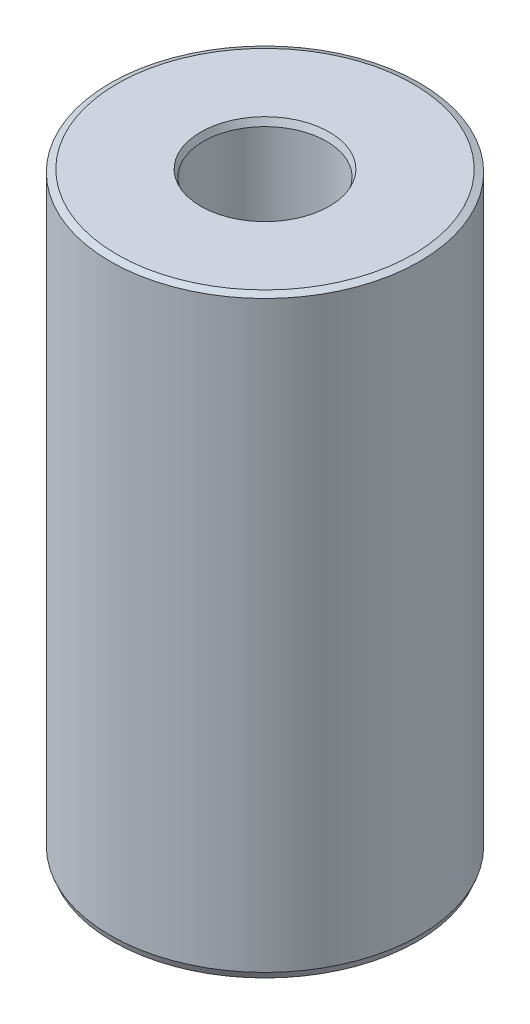
from build123d import *
from OCP.BRepFilletAPI import BRepFilletAPI_MakeChamfer

# Parameters (mm, degrees)
SKETCH1_R           = 25
BOSS_EXTRUDE1_DEPTH = 95.874018808
SKETCH2_R           = 9.962908398
CUT_EXTRUDE1_DEPTH  = 103.185260593
CHAMFER1_SIZE       = 0.433770531
CHAMFER1_SIZE2      = 1.08448728


with BuildPart() as part:
    # Sketch1 → Boss-Extrude1 (new body)
    with BuildSketch(Plane(origin=(0, 0, 0), x_dir=(1, 0, 0), z_dir=(0, 1, 0))):
        Circle(SKETCH1_R)
    extrude(amount=BOSS_EXTRUDE1_DEPTH)

    # Sketch2 → Cut-Extrude1 (cut, through all)
    with BuildSketch(Plane(origin=(0, 0, 0), x_dir=(1, 0, 0), z_dir=(0, 1, 0))):
        Circle(SKETCH2_R)
    extrude(amount=CUT_EXTRUDE1_DEPTH, mode=Mode.SUBTRACT)

    # Chamfer1: one chamfer whose edges measure the first distance from different faces: ONE call of the kernel's chamfer builder (chamfer() names one face for all edges)
    chamfer1_edges_1 = [part.edges().sort_by_distance(p)[0] for p in [
        (-9.962908398, 95.874018808, 0),
    ]]
    chamfer1_side_1 = [part.faces().sort_by_distance(p)[0] for p in [
        (-24.292893219, 95.874018808, 0),
    ]]
    chamfer1_edges_2 = [part.edges().sort_by_distance(p)[0] for p in [
        (-9.962908398, 0, 0),
    ]]
    chamfer1_side_2 = [part.faces().sort_by_distance(p)[0] for p in [
        (-9.962908398, 47.937009404, 0),
    ]]
    chamfer1_edges_3 = [part.edges().sort_by_distance(p)[0] for p in [
        (-25, 0, 0),
    ]]
    chamfer1_side_3 = [part.faces().sort_by_distance(p)[0] for p in [
        (-24.292893219, 0, 0),
    ]]
    chamfer1_edges_4 = [part.edges().sort_by_distance(p)[0] for p in [
        (-25, 95.874018808, 0),
    ]]
    chamfer1_side_4 = [part.faces().sort_by_distance(p)[0] for p in [
        (-25, 47.937009404, 0),
    ]]
    chamfer1 = BRepFilletAPI_MakeChamfer(part.part.solid().wrapped)
    for e in chamfer1_edges_1:
        chamfer1.Add(CHAMFER1_SIZE, CHAMFER1_SIZE2, e.wrapped, chamfer1_side_1[0].wrapped)  # the first distance lies on this face
    for e in chamfer1_edges_2:
        chamfer1.Add(CHAMFER1_SIZE, CHAMFER1_SIZE2, e.wrapped, chamfer1_side_2[0].wrapped)  # the first distance lies on this face
    for e in chamfer1_edges_3:
        chamfer1.Add(CHAMFER1_SIZE, CHAMFER1_SIZE2, e.wrapped, chamfer1_side_3[0].wrapped)  # the first distance lies on this face
    for e in chamfer1_edges_4:
        chamfer1.Add(CHAMFER1_SIZE, CHAMFER1_SIZE2, e.wrapped, chamfer1_side_4[0].wrapped)  # the first distance lies on this face
    add(Compound.cast(chamfer1.Shape()), mode=Mode.REPLACE)


solid = part.part
